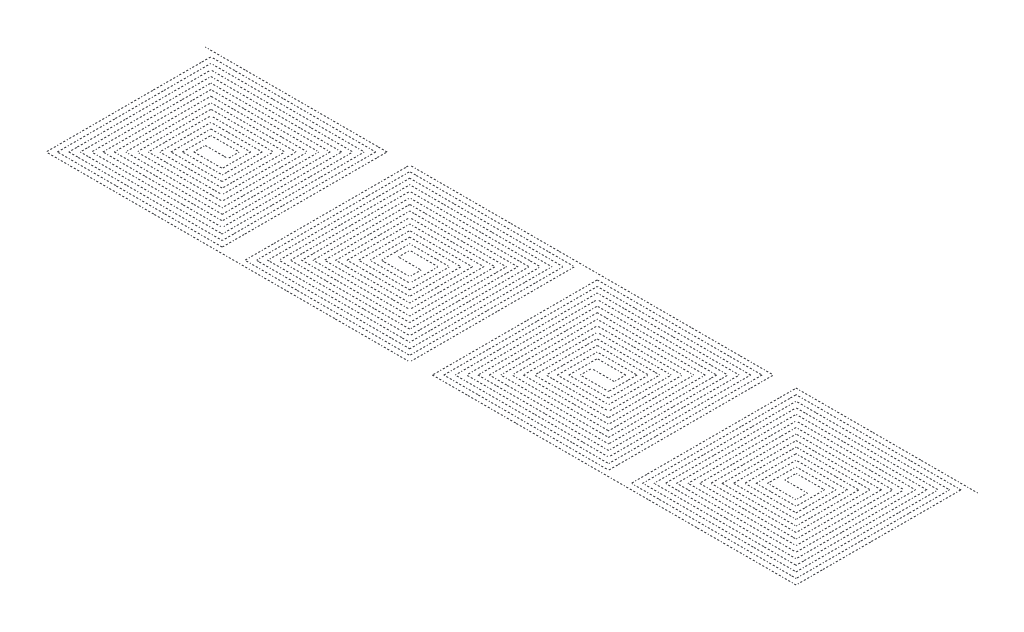
from build123d import *

# Parameters (mm, degrees)
SWEEP1_START         = -0.0002
SWEEP1_DEPTH         = 0.0004
MIRROR2_START        = -0.0002
MIRROR2_COPY_1_DEPTH = 0.0004


# Read off the part's stored shape, not the designer's step: Sweep1
with BuildPart() as part:
    # Sweep1 outline → Sweep1 (new body)
    with BuildSketch(Plane(origin=(0, 0, 0), x_dir=(1, 0, 0), z_dir=(0, 1, 0)).offset(SWEEP1_START)):
        Polygon((-7.495, 7.495), (8.5, 7.495), (8.5, 7.505), (-7.505, 7.505), (-7.505, -7.005), (7.005, -7.005), (7.005, 6.505), (-6.505, 6.505), (-6.505, -6.005), (6.005, -6.005), (6.005, 5.505), (-5.505, 5.505), (-5.505, -5.005), (5.005, -5.005), (5.005, 4.505), (-4.505, 4.505), (-4.505, -4.005), (4.005, -4.005), (4.005, 3.505), (-3.505, 3.505), (-3.505, -3.014104176), (3.014104176, -3.014104176), (3.014104176, 2.507728968), (-2.507728968, 2.507728968), (-2.507728968, -2.010049247), (2.010049247, -2.010049247), (2.010049247, 1.505350109), (-1.505350109, 1.505350109), (-1.505350109, -1.005002171), (1.005002171, -1.005002171), (1.005002171, 0.005), (-0.995002171, 0.005), (-0.995002171, 0.995002171), (1.495350109, 0.995002171), (1.495350109, -1.495350109), (-2.000049247, -1.495350109), (-2.000049247, 2.000049247), (2.497728968, 2.000049247), (2.497728968, -2.497728968), (-3.004104176, -2.497728968), (-3.004104176, 3.004104176), (3.495, 3.004104176), (3.495, -3.495), (-3.995, -3.495), (-3.995, 3.995), (4.495, 3.995), (4.495, -4.495), (-4.995, -4.495), (-4.995, 4.995), (5.495, 4.995), (5.495, -5.495), (-5.995, -5.495), (-5.995, 5.995), (6.495, 5.995), (6.495, -6.495), (-6.995, -6.495), (-6.995, 6.995), (7.495, 6.995), (7.495, -7.495), (-8.5, -7.495), (-8.5, -7.505), (7.505, -7.505), (7.505, 7.005), (-7.005, 7.005), (-7.005, -6.505), (6.505, -6.505), (6.505, 6.005), (-6.005, 6.005), (-6.005, -5.505), (5.505, -5.505), (5.505, 5.005), (-5.005, 5.005), (-5.005, -4.505), (4.505, -4.505), (4.505, 4.005), (-4.005, 4.005), (-4.005, -3.505), (3.505, -3.505), (3.505, 3.014104176), (-3.014104176, 3.014104176), (-3.014104176, -2.507728968), (2.507728968, -2.507728968), (2.507728968, 2.010049247), (-2.010049247, 2.010049247), (-2.010049247, -1.505350109), (1.505350109, -1.505350109), (1.505350109, 1.005002171), (-1.005002171, 1.005002171), (-1.005002171, -0.005), (0.995002171, -0.005), (0.995002171, -0.995002171), (-1.495350109, -0.995002171), (-1.495350109, 1.495350109), (2.000049247, 1.495350109), (2.000049247, -2.000049247), (-2.497728968, -2.000049247), (-2.497728968, 2.497728968), (3.004104176, 2.497728968), (3.004104176, -3.004104176), (-3.495, -3.004104176), (-3.495, 3.495), (3.995, 3.495), (3.995, -3.995), (-4.495, -3.995), (-4.495, 4.495), (4.995, 4.495), (4.995, -4.995), (-5.495, -4.995), (-5.495, 5.495), (5.995, 5.495), (5.995, -5.995), (-6.495, -5.995), (-6.495, 6.495), (6.995, 6.495), (6.995, -6.995), (-7.495, -6.995), align=None)
    sweep1 = extrude(amount=SWEEP1_DEPTH)

    # Mirror1: Sweep1 across plane
    add(sweep1.mirror(Plane.ZY.offset(8.5)))



with BuildPart() as mirror2_1:
    # Mirror2: Sweep1 across plane
    add(sweep1.mirror(Plane.ZY.offset(25.5)))


with BuildPart() as part_1:
    add(part.part)

    add(mirror2_1.part)  # Mirror2 copy 1 merges Mirror2_1
    # Mirror2 copy 1 sketch → Mirror2 copy 1 (add)
    with BuildSketch(Plane(origin=(-34, 0, 0), x_dir=(1, 0, 0), z_dir=(0, 1, 0)).offset(MIRROR2_START)):
        Polygon((-7.495, 7.495), (8.5, 7.495), (8.5, 7.505), (-7.505, 7.505), (-7.505, -7.005), (7.005, -7.005), (7.005, 6.505), (-6.505, 6.505), (-6.505, -6.005), (6.005, -6.005), (6.005, 5.505), (-5.505, 5.505), (-5.505, -5.005), (5.005, -5.005), (5.005, 4.505), (-4.505, 4.505), (-4.505, -4.005), (4.005, -4.005), (4.005, 3.505), (-3.505, 3.505), (-3.505, -3.014104176), (3.014104176, -3.014104176), (3.014104176, 2.507728968), (-2.507728968, 2.507728968), (-2.507728968, -2.010049247), (2.010049247, -2.010049247), (2.010049247, 1.505350109), (-1.505350109, 1.505350109), (-1.505350109, -1.005002171), (1.005002171, -1.005002171), (1.005002171, 0.005), (-0.995002171, 0.005), (-0.995002171, 0.995002171), (1.495350109, 0.995002171), (1.495350109, -1.495350109), (-2.000049247, -1.495350109), (-2.000049247, 2.000049247), (2.497728968, 2.000049247), (2.497728968, -2.497728968), (-3.004104176, -2.497728968), (-3.004104176, 3.004104176), (3.495, 3.004104176), (3.495, -3.495), (-3.995, -3.495), (-3.995, 3.995), (4.495, 3.995), (4.495, -4.495), (-4.995, -4.495), (-4.995, 4.995), (5.495, 4.995), (5.495, -5.495), (-5.995, -5.495), (-5.995, 5.995), (6.495, 5.995), (6.495, -6.495), (-6.995, -6.495), (-6.995, 6.995), (7.495, 6.995), (7.495, -7.495), (-8.5, -7.495), (-8.5, -7.505), (7.505, -7.505), (7.505, 7.005), (-7.005, 7.005), (-7.005, -6.505), (6.505, -6.505), (6.505, 6.005), (-6.005, 6.005), (-6.005, -5.505), (5.505, -5.505), (5.505, 5.005), (-5.005, 5.005), (-5.005, -4.505), (4.505, -4.505), (4.505, 4.005), (-4.005, 4.005), (-4.005, -3.505), (3.505, -3.505), (3.505, 3.014104176), (-3.014104176, 3.014104176), (-3.014104176, -2.507728968), (2.507728968, -2.507728968), (2.507728968, 2.010049247), (-2.010049247, 2.010049247), (-2.010049247, -1.505350109), (1.505350109, -1.505350109), (1.505350109, 1.005002171), (-1.005002171, 1.005002171), (-1.005002171, -0.005), (0.995002171, -0.005), (0.995002171, -0.995002171), (-1.495350109, -0.995002171), (-1.495350109, 1.495350109), (2.000049247, 1.495350109), (2.000049247, -2.000049247), (-2.497728968, -2.000049247), (-2.497728968, 2.497728968), (3.004104176, 2.497728968), (3.004104176, -3.004104176), (-3.495, -3.004104176), (-3.495, 3.495), (3.995, 3.495), (3.995, -3.995), (-4.495, -3.995), (-4.495, 4.495), (4.995, 4.495), (4.995, -4.995), (-5.495, -4.995), (-5.495, 5.495), (5.995, 5.495), (5.995, -5.995), (-6.495, -5.995), (-6.495, 6.495), (6.995, 6.495), (6.995, -6.995), (-7.495, -6.995), align=None)
    extrude(amount=MIRROR2_COPY_1_DEPTH)


solid = part_1.part
